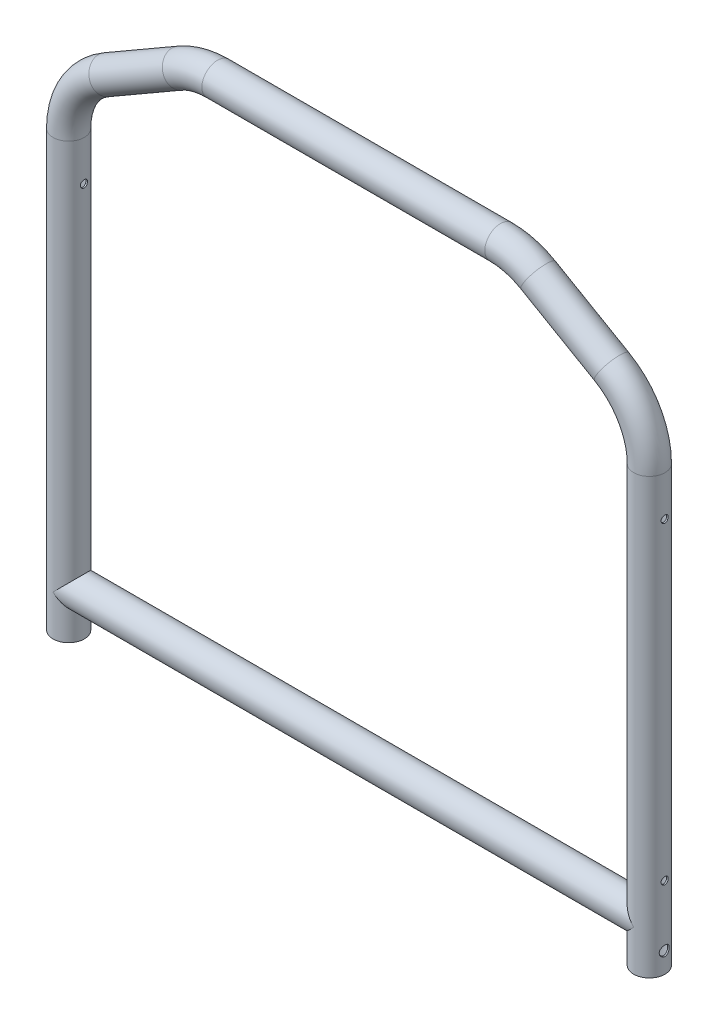
from build123d import *

# Parameters (mm, degrees)
SKETCH2_R                            = 11
SKETCH2_R_2                          = 10
BOSS_EXTRUDE1_REACH                  = 445.723
BOSS_EXTRUDE1_END_RADIUS             = 11
SKETCH3_R                            = 11
SKETCH3_R_2                          = 10
BOSS_EXTRUDE1_DIRECTION_2_REACH      = 445.723
BOSS_EXTRUDE1_DIRECTION_2_END_RADIUS = 11
SKETCH5_R                            = 2.5
SKETCH5_R_2                          = 3.5
CUT_EXTRUDE1_DEPTH                   = 200
SKETCH6_R                            = 2.5
CUT_EXTRUDE2_DEPTH                   = 200


with BuildPart() as part:
    # Sweep1: sweep along a path in Sketch1
    with BuildLine(Plane.XY) as sweep1_path:
        Line((204, -388), (204, -82.797389364))
        ThreePointArc((204, -82.797389364), (196.899346401, -56.297389364), (177.5, -36.898042963))
        Line((177.5, -36.898042963), (125.889407689, -7.100653599))
        ThreePointArc((125.889407689, -7.100653599), (113.10681708, -1.805931207), (99.389407689, 0))
        Line((99.389407689, 0), (-99.389407689, 0))
        ThreePointArc((-99.389407689, 0), (-113.10681708, -1.805931207), (-125.889407689, -7.100653599))
        Line((-125.889407689, -7.100653599), (-177.5, -36.898042963))
        ThreePointArc((-177.5, -36.898042963), (-196.899346401, -56.297389364), (-204, -82.797389364))
        Line((-204, -82.797389364), (-204, -388))
    # Sketch2 → Sweep1 (sweep)
    with BuildSketch(Plane(origin=(204, -388, 0), x_dir=(-1, 0, 0), z_dir=(0, -1, 0))):
        Circle(SKETCH2_R)
        Circle(SKETCH2_R_2, mode=Mode.SUBTRACT)
    sweep(path=sweep1_path.line)

    # Boss-Extrude1: up to this cylinder (the profile starts outside it)
    boss_extrude1_end = Plane(origin=(204, -359.399207, 0), z_dir=(0, -1, 0)) * Cylinder(BOSS_EXTRUDE1_END_RADIUS, 914.446, mode=Mode.PRIVATE)
    # Sketch3 → Boss-Extrude1 (add, up to the surface)
    with BuildSketch(Plane(origin=(0, 0, 0), x_dir=(0, 0, -1), z_dir=(1, 0, 0)), mode=Mode.PRIVATE) as boss_extrude1_sk1:
        with Locations((0, -359.399206555)):
            Circle(SKETCH3_R)
        with Locations((0, -359.399206555)):
            Circle(SKETCH3_R_2, mode=Mode.SUBTRACT)
    boss_extrude1_tool1 = extrude(boss_extrude1_sk1.sketch, amount=BOSS_EXTRUDE1_REACH, mode=Mode.PRIVATE) - boss_extrude1_end
    add(boss_extrude1_tool1.solids().sort_by_distance((0, -359.399207, 10.688873))[0])

    # Boss-Extrude1 direction 2: up to this cylinder (the profile starts outside it)
    boss_extrude1_direction_2_end = Plane(origin=(-204, -359.399207, 0), z_dir=(0, 1, 0)) * Cylinder(BOSS_EXTRUDE1_DIRECTION_2_END_RADIUS, 914.446, mode=Mode.PRIVATE)
    # Sketch3 → Boss-Extrude1 direction 2 (add, up to the surface)
    with BuildSketch(Plane(origin=(0, 0, 0), x_dir=(0, 0, -1), z_dir=(1, 0, 0)), mode=Mode.PRIVATE) as boss_extrude1_direction_2_sk1:
        with Locations((0, -359.399206555)):
            Circle(SKETCH3_R)
        with Locations((0, -359.399206555)):
            Circle(SKETCH3_R_2, mode=Mode.SUBTRACT)
    boss_extrude1_direction_2_tool1 = extrude(boss_extrude1_direction_2_sk1.sketch, amount=-BOSS_EXTRUDE1_DIRECTION_2_REACH, mode=Mode.PRIVATE) - boss_extrude1_direction_2_end
    add(boss_extrude1_direction_2_tool1.solids().sort_by_distance((0, -359.399207, 10.688873))[0])

    # Sketch5 → Cut-Extrude1 (cut)
    with BuildSketch(Plane(origin=(-204, -388, 0), x_dir=(0, 0, 1), z_dir=(-1, 0, 0))):
        with Locations((0, 57)):
            Circle(SKETCH5_R)
        with Locations((0, 14.303193193)):
            Circle(SKETCH5_R_2)
    cut_extrude1 = extrude(amount=CUT_EXTRUDE1_DEPTH, mode=Mode.SUBTRACT)

    # Sketch6 → Cut-Extrude2 (cut, symmetric)
    with BuildSketch(Plane(origin=(-204, -388, 0), x_dir=(0, 0, 1), z_dir=(-1, 0, 0))):
        with Locations((0, 277)):
            Circle(SKETCH6_R)
    cut_extrude2 = extrude(amount=CUT_EXTRUDE2_DEPTH, both=True, mode=Mode.SUBTRACT)

    # Mirror1: Cut-Extrude1, Cut-Extrude2 across plane
    add(cut_extrude1.mirror(Plane(origin=(0, 0, 0), x_dir=(0, 0, 1), z_dir=(1, 0, 0))), mode=Mode.SUBTRACT)
    add(cut_extrude2.mirror(Plane(origin=(0, 0, 0), x_dir=(0, 0, 1), z_dir=(1, 0, 0))), mode=Mode.SUBTRACT)


solid = part.part
